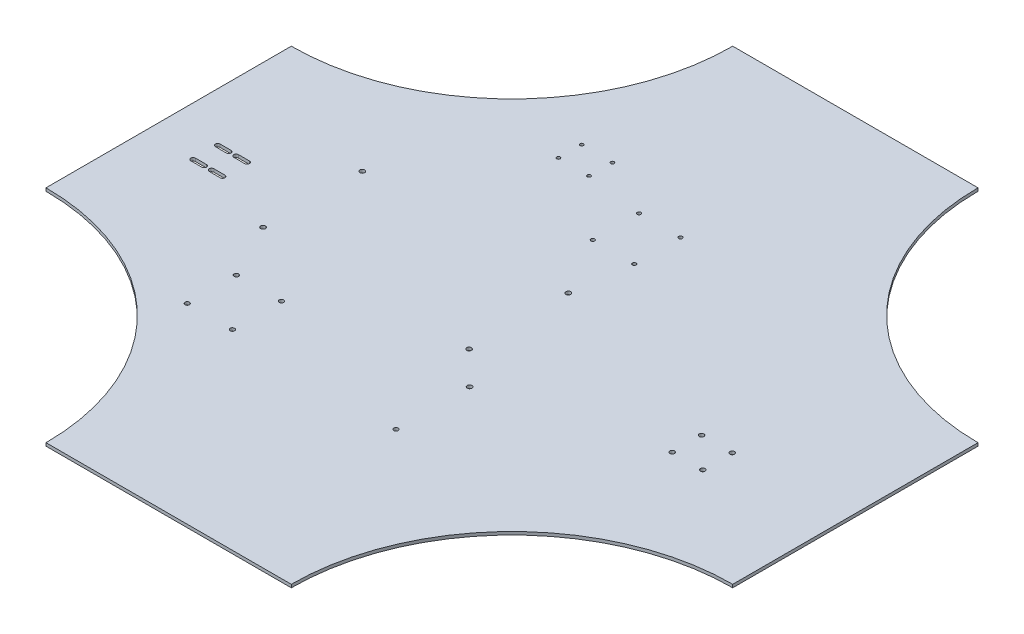
from build123d import *

# Parameters (mm, degrees)
BOSS_EXTRUDE1_DEPTH     = 3.175
CUT_EXTRUDE1_DEPTH      = 503.904365287
CUT_EXTRUDE1_DEPTH_BACK = 503.904365287
SKETCH4_R               = 2.413
CUT_EXTRUDE2_DEPTH      = 503.904365287
SKETCH5_R               = 2.5
SKETCH5_R_2             = 2.47796547
CUT_EXTRUDE3_DEPTH      = 503.904365287
SKETCH6_R               = 2.321781934
SKETCH6_R_2             = 2.308248968
SKETCH6_R_3             = 2.5
SKETCH6_R_4             = 1.905
SKETCH6_R_5             = 1.75
CUT_EXTRUDE4_DEPTH      = 503.904365287


with BuildPart() as part:
    # Sketch1 → Boss-Extrude1 (new body)
    with BuildSketch(Plane(origin=(0, 0, 0), x_dir=(1, 0, 0), z_dir=(0, 1, 0))):
        with BuildLine():
            Line((-127, -355.6), (127, -355.6))
            ThreePointArc((127, -355.6), (193.955389821, -193.955389821), (355.6, -127))
            Line((355.6, -127), (355.6, 127))
            ThreePointArc((355.6, 127), (193.955389821, 193.955389821), (127, 355.6))
            Line((127, 355.6), (-127, 355.6))
            ThreePointArc((-127, 355.6), (-193.955389821, 193.955389821), (-355.6, 127))
            Line((-355.6, 127), (-355.6, -127))
            ThreePointArc((-355.6, -127), (-193.955389821, -193.955389821), (-127, -355.6))
        make_face()
    extrude(amount=BOSS_EXTRUDE1_DEPTH)

    # Sketch2 → Cut-Extrude1 (cut, two sides: drawn at the far end of the back side and taken through both)
    with BuildSketch(Plane(origin=(0, 3.175, 0), x_dir=(1, 0, 0), z_dir=(0, 1, 0)).offset(-CUT_EXTRUDE1_DEPTH_BACK)):
        with BuildLine():
            Line((-304.8, 2.413), (-293.37, 2.413))
            ThreePointArc((-293.37, 2.413), (-290.957, 0), (-293.37, -2.413))
            Line((-293.37, -2.413), (-304.8, -2.413))
            ThreePointArc((-304.8, -2.413), (-307.213, 0), (-304.8, 2.413))
        make_face()
        with BuildLine():
            Line((-304.8, -22.987), (-293.37, -22.987))
            ThreePointArc((-293.37, -22.987), (-290.957, -25.4), (-293.37, -27.813))
            Line((-293.37, -27.813), (-304.8, -27.813))
            ThreePointArc((-304.8, -27.813), (-307.213, -25.4), (-304.8, -22.987))
        make_face()
        with BuildLine():
            Line((-285.75, -2.413), (-274.32, -2.413))
            ThreePointArc((-274.32, -2.413), (-271.907, 0), (-274.32, 2.413))
            Line((-274.32, 2.413), (-285.75, 2.413))
            ThreePointArc((-285.75, 2.413), (-288.163, 0), (-285.75, -2.413))
        make_face()
        with BuildLine():
            Line((-285.75, -22.987), (-274.32, -22.987))
            ThreePointArc((-274.32, -22.987), (-271.907, -25.4), (-274.32, -27.813))
            Line((-274.32, -27.813), (-285.75, -27.813))
            ThreePointArc((-285.75, -27.813), (-288.163, -25.4), (-285.75, -22.987))
        make_face()
    extrude(amount=CUT_EXTRUDE1_DEPTH + CUT_EXTRUDE1_DEPTH_BACK, mode=Mode.SUBTRACT)

    # Sketch4 → Cut-Extrude2 (cut, through all)
    with BuildSketch(Plane(origin=(0, 3.175, 0), x_dir=(1, 0, 0), z_dir=(0, 1, 0))):
        with Locations((237.49, -9.430177049)):
            Circle(SKETCH4_R)
        with Locations((205.74, -9.430177049)):
            Circle(SKETCH4_R)
        with Locations((237.49, -39.910177049)):
            Circle(SKETCH4_R)
        with Locations((205.74, -39.910177049)):
            Circle(SKETCH4_R)
    extrude(amount=-CUT_EXTRUDE2_DEPTH, mode=Mode.SUBTRACT)

    # Sketch5 → Cut-Extrude3 (cut, through all)
    with BuildSketch(Plane.XZ):
        with Locations((-207.790149601, 50.01656837)):
            Circle(SKETCH5_R)
        with Locations((-206.624048203, -51.576739518)):
            Circle(SKETCH5_R)
        with Locations((8.09562966, 52.494533839)):
            Circle(SKETCH5_R_2)
        with Locations((9.261731058, -49.098774048)):
            Circle(SKETCH5_R)
    extrude(amount=-CUT_EXTRUDE3_DEPTH, mode=Mode.SUBTRACT)

    # Sketch6 → Cut-Extrude4 (cut, through all)
    with BuildSketch(Plane.XZ):
        with Locations((-131.96570437, 157.594741445)):
            Circle(SKETCH6_R)
        with Locations((-131.96570437, 106.794741445)):
            Circle(SKETCH6_R)
        with Locations((-178.700591901, 106.794741445)):
            Circle(SKETCH6_R)
        with Locations((-178.700591901, 157.594741445)):
            Circle(SKETCH6_R)
        with Locations((42.265908941, 162.337536061)):
            Circle(SKETCH6_R_2)
        with Locations((42.265908941, 86.137536061)):
            Circle(SKETCH6_R_3)
        with Locations((17.371687145, -109.265722508)):
            Circle(SKETCH6_R_4)
        with Locations((-25.681149945, -109.384160374)):
            Circle(SKETCH6_R_4)
        with Locations((-25.549785233, -157.135979683)):
            Circle(SKETCH6_R_4)
        with Locations((17.503045383, -157.015188359)):
            Circle(SKETCH6_R_4)
        with Locations((-84.882409293, -188.871278488)):
            Circle(SKETCH6_R_5)
        with Locations((-85.091846145, -164.872192335)):
            Circle(SKETCH6_R_5)
        with Locations((-116.881190831, -189.150527624)):
            Circle(SKETCH6_R_5)
        with Locations((-117.090627683, -165.151441471)):
            Circle(SKETCH6_R_5)
    extrude(amount=-CUT_EXTRUDE4_DEPTH, mode=Mode.SUBTRACT)


solid = part.part
